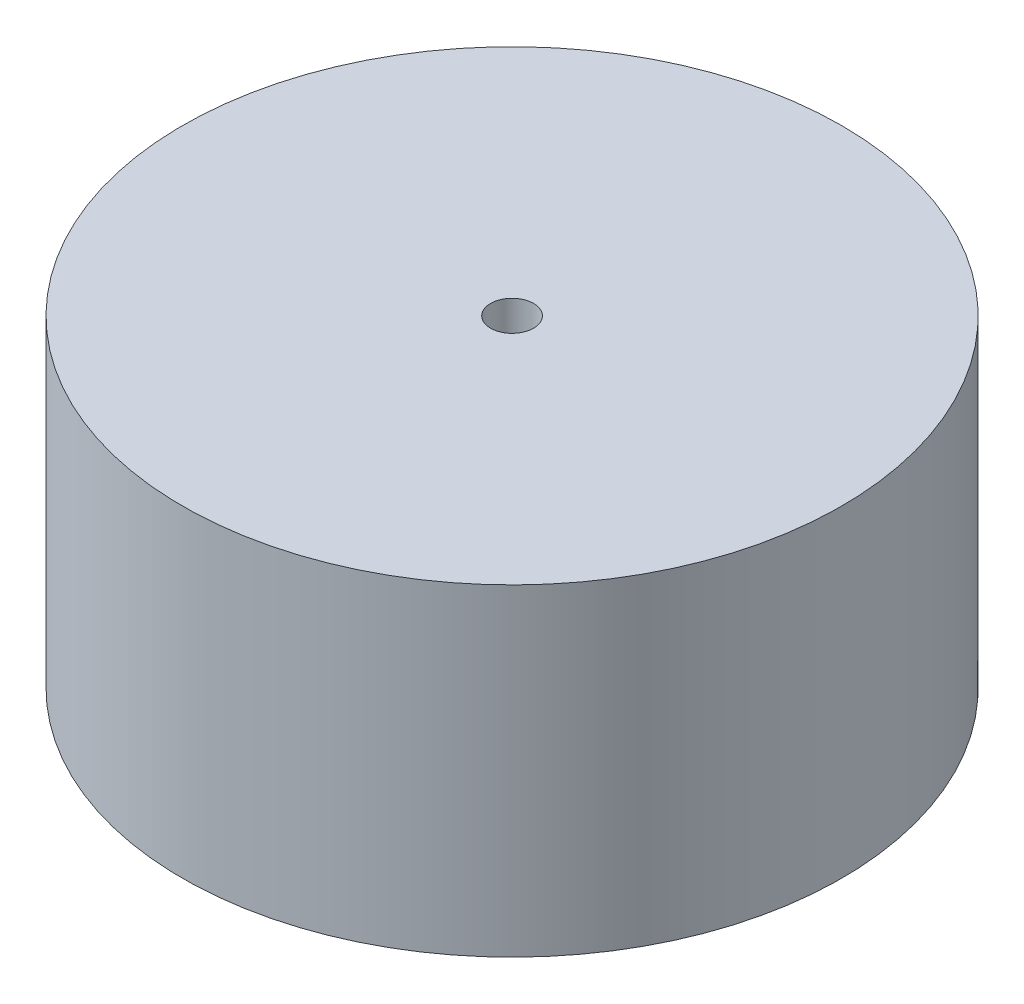
from build123d import *

# Parameters (mm, degrees)
SKETCH1_R           = 23
BOSS_EXTRUDE1_DEPTH = 22.5
SKETCH3_R           = 1.5
CUT_EXTRUDE1_DEPTH  = 64.514112944


with BuildPart() as part:
    # Sketch1 → Boss-Extrude1 (new body)
    with BuildSketch(Plane(origin=(0, 0, 0), x_dir=(1, 0, 0), z_dir=(0, 1, 0))):
        with Locations((-29.725277397, 4.346620751)):
            Circle(SKETCH1_R)
    extrude(amount=BOSS_EXTRUDE1_DEPTH)

    # Sketch3 → Cut-Extrude1 (cut, through all)
    with BuildSketch(Plane.XZ):
        with Locations((-29.725277397, -4.346620751)):
            Circle(SKETCH3_R)
    extrude(amount=-CUT_EXTRUDE1_DEPTH, mode=Mode.SUBTRACT)


solid = part.part
